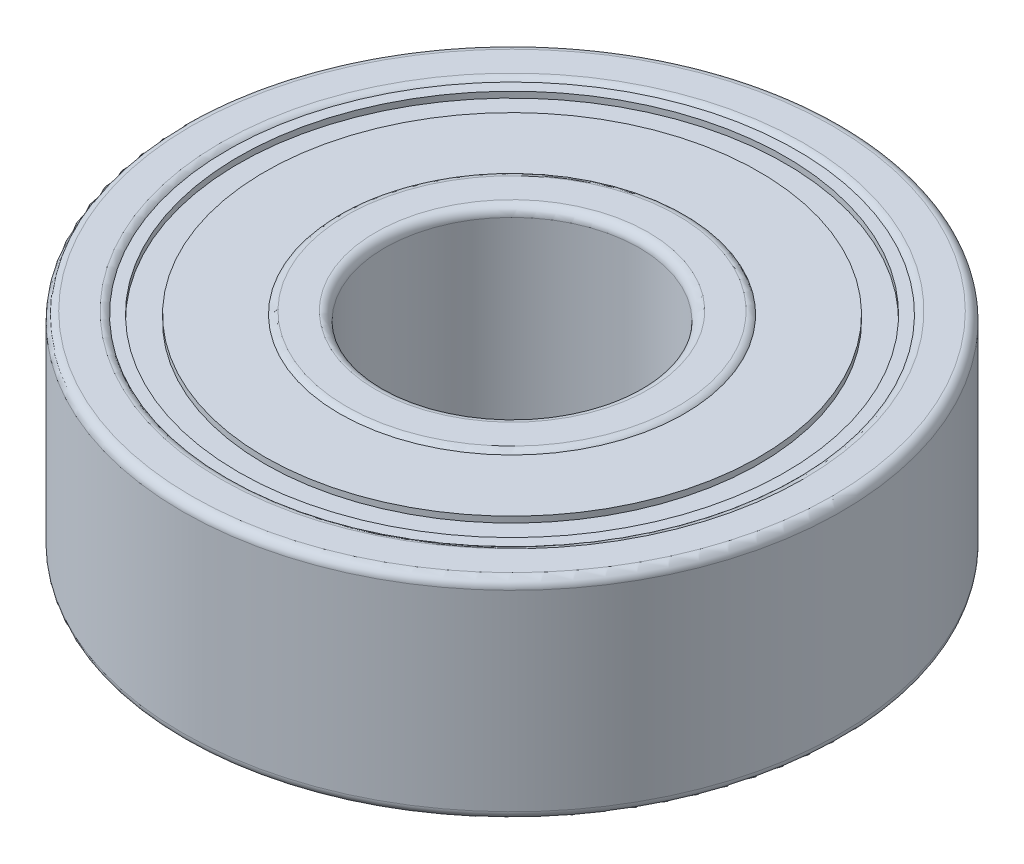
from build123d import *

# Parameters (mm, degrees)
SKETCH1_R           = 5.75
SKETCH1_R_2         = 4.25
BOSS_EXTRUDE1_DEPTH = 7
BOSS_EXTRUDE2_START = 0.1
SKETCH2_R           = 9.5
SKETCH2_R_2         = 5.75
BOSS_EXTRUDE2_DEPTH = 6.8
SKETCH3_R           = 9.125
SKETCH3_R_2         = 8.25
CUT_EXTRUDE1_DEPTH  = 0.2
SKETCH4_R           = 11
SKETCH4_R_2         = 9.5
BOSS_EXTRUDE3_DEPTH = 7
FILLET1_R           = 0.3


with BuildPart() as part:
    # Sketch1 → Boss-Extrude1 (new body)
    with BuildSketch(Plane(origin=(0, 0, 0), x_dir=(1, 0, 0), z_dir=(0, 1, 0))):
        with Locations(Location((0, 0, 0), (0, 0, 270))):
            Circle(SKETCH1_R)
        with Locations(Location((0, 0, 0), (0, 0, 270))):
            Circle(SKETCH1_R_2, mode=Mode.SUBTRACT)
    extrude(amount=BOSS_EXTRUDE1_DEPTH)

    # Sketch2 → Boss-Extrude2 (add)
    with BuildSketch(Plane(origin=(0, 0, 0), x_dir=(1, 0, 0), z_dir=(0, 1, 0)).offset(BOSS_EXTRUDE2_START)):
        with Locations(Location((0, 0, 0), (0, 0, 270))):
            Circle(SKETCH2_R)
        with Locations(Location((0, 0, 0), (0, 0, 270))):
            Circle(SKETCH2_R_2, mode=Mode.SUBTRACT)
    extrude(amount=BOSS_EXTRUDE2_DEPTH)

    # Sketch3 → Cut-Extrude1 (cut)
    with BuildSketch(Plane(origin=(0, 6.9, 0), x_dir=(1, 0, 0), z_dir=(0, 1, 0))):
        with Locations(Location((0, 0, 0), (0, 0, 270))):
            Circle(SKETCH3_R)
        with Locations(Location((0, 0, 0), (0, 0, 270))):
            Circle(SKETCH3_R_2, mode=Mode.SUBTRACT)
    extrude(amount=-CUT_EXTRUDE1_DEPTH, mode=Mode.SUBTRACT)

    # Sketch4 → Boss-Extrude3 (add)
    with BuildSketch(Plane(origin=(0, 0, 0), x_dir=(1, 0, 0), z_dir=(0, 1, 0))):
        with Locations(Location((0, 0, 0), (0, 0, 270))):
            Circle(SKETCH4_R)
        with Locations(Location((0, 0, 0), (0, 0, 270))):
            Circle(SKETCH4_R_2, mode=Mode.SUBTRACT)
    extrude(amount=BOSS_EXTRUDE3_DEPTH)

    # Fillet1
    # the kernel refuses this fillet: 0.3 mm, written as the material it takes off along each edge
    with BuildSketch(Plane(origin=(0, 0, 0), x_dir=(0, 0, 1), z_dir=(-1, 0, 0))) as fillet1_piece_1:
        with BuildLine():
            CenterArc((5.526393202, 0.3), FILLET1_R, 270, 48.189685104)
            Line((5.526393202, 0), (5.526393202, -0.006))
            Line((5.526393202, -0.006), (5.75, -0.006))
            Line((5.75, -0.006), (5.756, 0))
            ThreePointArc((5.756, 0), (5.756, 0.05), (5.754472136, 0.096))
            Line((5.754472136, 0.096), (5.75, 0.1))
        make_face()
    revolve(axis=Axis((0, 0, 0), (0, 1, 0)), mode=Mode.SUBTRACT)
    with BuildSketch(Plane(origin=(0, 7, 0), x_dir=(0, 0, 1), z_dir=(-1, 0, 0))) as fillet1_piece_2:
        with BuildLine():
            CenterArc((11 - FILLET1_R, -FILLET1_R), FILLET1_R, 0, 90)
            Line((11 - FILLET1_R, 0), (11 - FILLET1_R, FILLET1_R * 0.02))
            Line((11 - FILLET1_R, FILLET1_R * 0.02), (11 + FILLET1_R * 0.02, FILLET1_R * 0.02))
            Line((11 + FILLET1_R * 0.02, FILLET1_R * 0.02), (11 + FILLET1_R * 0.02, -FILLET1_R))
            Line((11 + FILLET1_R * 0.02, -FILLET1_R), (11, -FILLET1_R))
        make_face()
    revolve(axis=Axis((0, 7, 0), (0, 1, 0)), mode=Mode.SUBTRACT)
    with BuildSketch(Plane(origin=(0, 0, 0), x_dir=(0, 0, 1), z_dir=(-1, 0, 0))) as fillet1_piece_3:
        with BuildLine():
            CenterArc((9.723606798, 0.3), FILLET1_R, 221.810314896, 48.189685104)
            Line((9.5, 0.1), (9.495527864, 0.096))
            ThreePointArc((9.495527864, 0.096), (9.494, 0.05), (9.494, 0))
            Line((9.494, 0), (9.5, -0.006))
            Line((9.5, -0.006), (9.723606798, -0.006))
            Line((9.723606798, -0.006), (9.723606798, 0))
        make_face()
    revolve(axis=Axis((0, 0, 0), (0, 1, 0)), mode=Mode.SUBTRACT)
    with BuildSketch(Plane(origin=(0, 0, 0), x_dir=(0, 0, 1), z_dir=(-1, 0, 0))) as fillet1_piece_4:
        with BuildLine():
            CenterArc((11 - FILLET1_R, FILLET1_R), FILLET1_R, 270, 90)
            Line((11 - FILLET1_R, 0), (11 - FILLET1_R, -FILLET1_R * 0.02))
            Line((11 - FILLET1_R, -FILLET1_R * 0.02), (11 + FILLET1_R * 0.02, -FILLET1_R * 0.02))
            Line((11 + FILLET1_R * 0.02, -FILLET1_R * 0.02), (11 + FILLET1_R * 0.02, FILLET1_R))
            Line((11 + FILLET1_R * 0.02, FILLET1_R), (11, FILLET1_R))
        make_face()
    revolve(axis=Axis((0, 0, 0), (0, 1, 0)), mode=Mode.SUBTRACT)
    with BuildSketch(Plane(origin=(0, 7, 0), x_dir=(0, 0, 1), z_dir=(-1, 0, 0))) as fillet1_piece_5:
        with BuildLine():
            CenterArc((9.723606798, -0.3), FILLET1_R, 90, 48.189685104)
            Line((9.5, -0.1), (9.495527864, -0.096))
            ThreePointArc((9.495527864, -0.096), (9.494, -0.05), (9.494, 0))
            Line((9.494, 0), (9.5, 0.006))
            Line((9.5, 0.006), (9.723606798, 0.006))
            Line((9.723606798, 0.006), (9.723606798, 0))
        make_face()
    revolve(axis=Axis((0, 7, 0), (0, 1, 0)), mode=Mode.SUBTRACT)
    with BuildSketch(Plane(origin=(0, 7, 0), x_dir=(0, 0, 1), z_dir=(-1, 0, 0))) as fillet1_piece_6:
        with BuildLine():
            CenterArc((5.526393202, -0.3), FILLET1_R, 41.810314896, 48.189685104)
            Line((5.75, -0.1), (5.754472136, -0.096))
            ThreePointArc((5.754472136, -0.096), (5.756, -0.05), (5.756, 0))
            Line((5.756, 0), (5.75, 0.006))
            Line((5.75, 0.006), (5.526393202, 0.006))
            Line((5.526393202, 0.006), (5.526393202, 0))
        make_face()
    revolve(axis=Axis((0, 7, 0), (0, 1, 0)), mode=Mode.SUBTRACT)
    with BuildSketch(Plane(origin=(0, 0, 0), x_dir=(0, 0, 1), z_dir=(-1, 0, 0))) as fillet1_piece_7:
        with BuildLine():
            CenterArc((4.25 + FILLET1_R, FILLET1_R), FILLET1_R, 180, 90)
            Line((4.25, FILLET1_R), (4.25 - FILLET1_R * 0.02, FILLET1_R))
            Line((4.25 - FILLET1_R * 0.02, FILLET1_R), (4.25 - FILLET1_R * 0.02, -FILLET1_R * 0.02))
            Line((4.25 - FILLET1_R * 0.02, -FILLET1_R * 0.02), (4.25 + FILLET1_R, -FILLET1_R * 0.02))
            Line((4.25 + FILLET1_R, -FILLET1_R * 0.02), (4.25 + FILLET1_R, 0))
        make_face()
    revolve(axis=Axis((0, 0, 0), (0, 1, 0)), mode=Mode.SUBTRACT)
    with BuildSketch(Plane(origin=(0, 7, 0), x_dir=(0, 0, 1), z_dir=(-1, 0, 0))) as fillet1_piece_8:
        with BuildLine():
            CenterArc((4.25 + FILLET1_R, -FILLET1_R), FILLET1_R, 90, 90)
            Line((4.25 + FILLET1_R, 0), (4.25 + FILLET1_R, FILLET1_R * 0.02))
            Line((4.25 + FILLET1_R, FILLET1_R * 0.02), (4.25 - FILLET1_R * 0.02, FILLET1_R * 0.02))
            Line((4.25 - FILLET1_R * 0.02, FILLET1_R * 0.02), (4.25 - FILLET1_R * 0.02, -FILLET1_R))
            Line((4.25 - FILLET1_R * 0.02, -FILLET1_R), (4.25, -FILLET1_R))
        make_face()
    revolve(axis=Axis((0, 7, 0), (0, 1, 0)), mode=Mode.SUBTRACT)


solid = part.part
